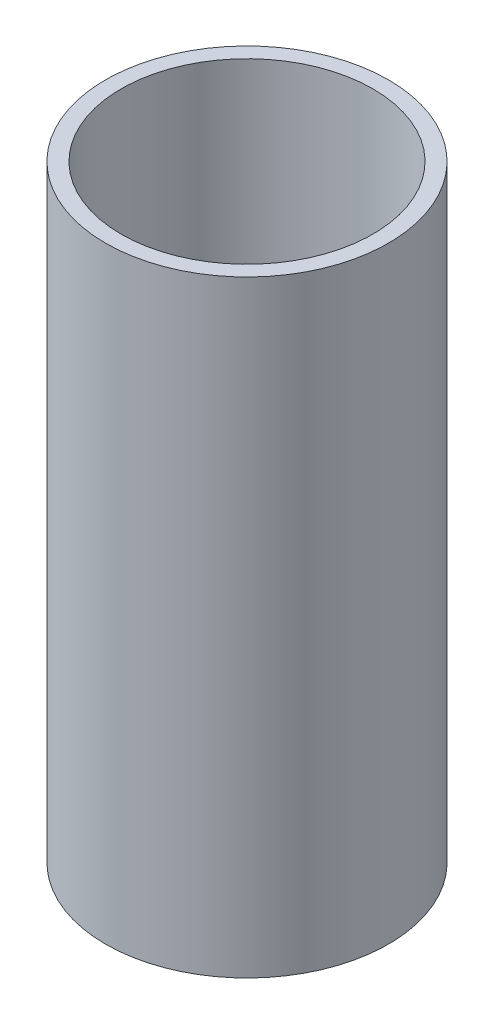
from build123d import *

# Parameters (mm, degrees)
SKETCH1_R           = 55
BOSS_EXTRUDE1_DEPTH = 236.007099816
SKETCH2_R           = 48.940301756
CUT_EXTRUDE1_DEPTH  = 249.494167263


with BuildPart() as part:
    # Sketch1 → Boss-Extrude1 (new body)
    with BuildSketch(Plane(origin=(0, 0, 0), x_dir=(1, 0, 0), z_dir=(0, 1, 0))):
        Circle(SKETCH1_R)
    extrude(amount=BOSS_EXTRUDE1_DEPTH)

    # Sketch2 → Cut-Extrude1 (cut, through all)
    with BuildSketch(Plane(origin=(0, 0, 0), x_dir=(1, 0, 0), z_dir=(0, 1, 0))):
        Circle(SKETCH2_R)
    extrude(amount=CUT_EXTRUDE1_DEPTH, mode=Mode.SUBTRACT)


solid = part.part
